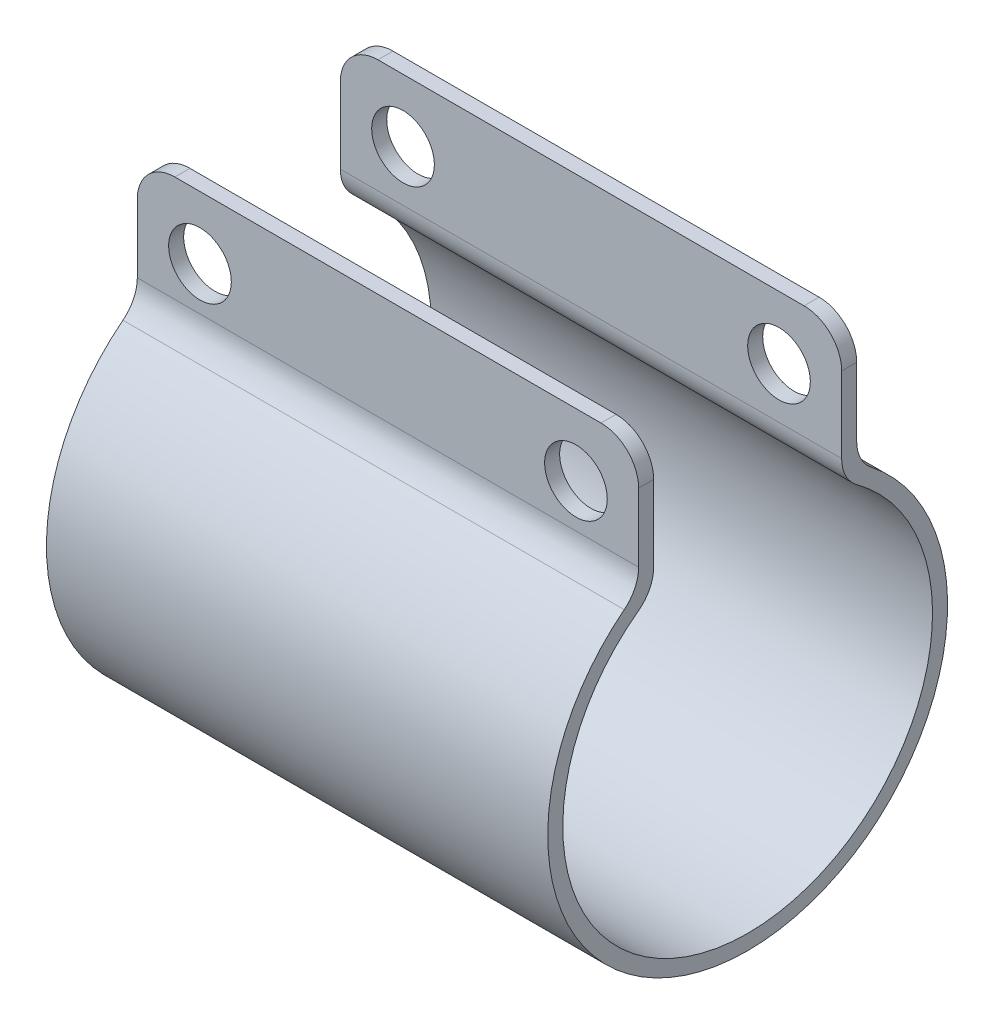
from build123d import *

# Parameters (mm, degrees)
BOSS_EXTRUDE1_DEPTH     = 50.8
CUT_EXTRUDE1_DEPTH      = 63.223284049
CUT_EXTRUDE1_DEPTH_BACK = 63.223284049
SKETCH2_R               = 3.175
FILLET1_R               = 3.81


with BuildPart() as part:
    # Sketch1 → Boss-Extrude1 (new body)
    with BuildSketch(Plane(origin=(0, 0, 0), x_dir=(0, 0, -1), z_dir=(1, 0, 0))):
        with BuildLine():
            Line((9.525, 16.130124961), (9.525, 29.677791118))
            Line((9.525, 29.677791118), (11.049, 29.677791118))
            Line((11.049, 29.677791118), (11.049, 16.977791118))
            ThreePointArc((11.049, 16.977791118), (0, -20.2565), (-11.049, 16.977791118))
            Line((-11.049, 16.977791118), (-11.049, 29.677791118))
            Line((-11.049, 29.677791118), (-9.525, 29.677791118))
            Line((-9.525, 29.677791118), (-9.525, 16.130124961))
            ThreePointArc((-9.525, 16.130124961), (0, -18.7325), (9.525, 16.130124961))
        make_face()
    extrude(amount=BOSS_EXTRUDE1_DEPTH)

    # Sketch2 → Cut-Extrude1 (cut, two sides: drawn at the far end of the back side and taken through both)
    with BuildSketch(Plane.XY.offset(-CUT_EXTRUDE1_DEPTH_BACK)):
        with Locations((6.35, 23.327791118)):
            Circle(SKETCH2_R)
        with Locations((44.45, 23.327791118)):
            Circle(SKETCH2_R)
    extrude(amount=CUT_EXTRUDE1_DEPTH + CUT_EXTRUDE1_DEPTH_BACK, mode=Mode.SUBTRACT)

    # Fillet1
    fillet1_edges = [part.edges().sort_by_distance(p)[0] for p in [
        (25.4, 16.977791118, 11.049),
        (25.4, 16.977791118, -11.049),
        (50.8, 29.677791118, 10.287),
        (50.8, 29.677791118, -10.287),
        (0, 29.677791118, -10.287),
        (0, 29.677791118, 10.287),
        (25.4, 16.130124961, 9.525),
        (25.4, 16.130124961, -9.525),
    ]]
    fillet(fillet1_edges, radius=FILLET1_R)


solid = part.part
